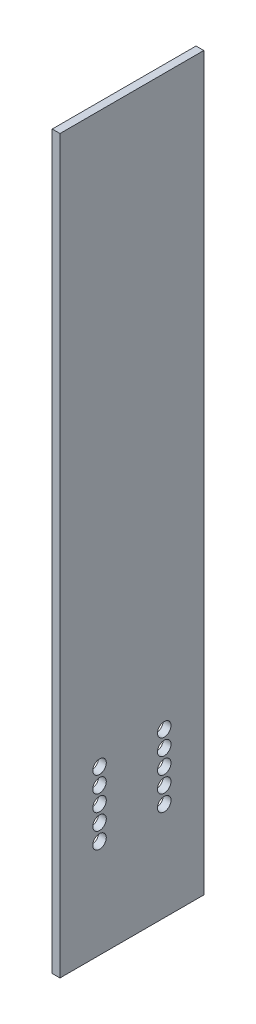
from build123d import *

# Parameters (mm, degrees)
SKETCH1_W                  = 56.4388
SKETCH1_H                  = 287.02
BOSS_EXTRUDE1_DEPTH        = 3.048
F_4_0_209_DIAMETER_HOLE1_D = 5.3086
LPATTERN1_COUNT            = 4
LPATTERN1_PITCH            = 6.35
LPATTERN1_COL_COUNT        = 2
LPATTERN1_COL_PITCH        = 6.35


with BuildPart() as part:
    # Sketch1 → Boss-Extrude1 (new body)
    with BuildSketch(Plane(origin=(0, 0, 0), x_dir=(0, 0, -1), z_dir=(1, 0, 0))):
        Rectangle(SKETCH1_W, SKETCH1_H)
    extrude(amount=BOSS_EXTRUDE1_DEPTH)

    # #4 (0.209) Diameter Hole1 (through all)
    with Locations(Plane(origin=(3.048, 0, 0), x_dir=(0, 0, -1), z_dir=(1, 0, 0))):
        with Locations((-12.7, -98.5012), (12.7, -98.5012)):
            f_4_0_209_diameter_hole1 = Hole(F_4_0_209_DIAMETER_HOLE1_D / 2)

    # LPattern1: #4 (0.209) Diameter Hole1 ×4
    with Locations(*[(0, i * LPATTERN1_PITCH, 0) for i in range(1, LPATTERN1_COUNT)]):
        add(f_4_0_209_diameter_hole1, mode=Mode.SUBTRACT)

    # LPattern1 col: #4 (0.209) Diameter Hole1 ×2
    with Locations(*[(0, -i * LPATTERN1_COL_PITCH, 0) for i in range(1, LPATTERN1_COL_COUNT)]):
        add(f_4_0_209_diameter_hole1, mode=Mode.SUBTRACT)


solid = part.part
